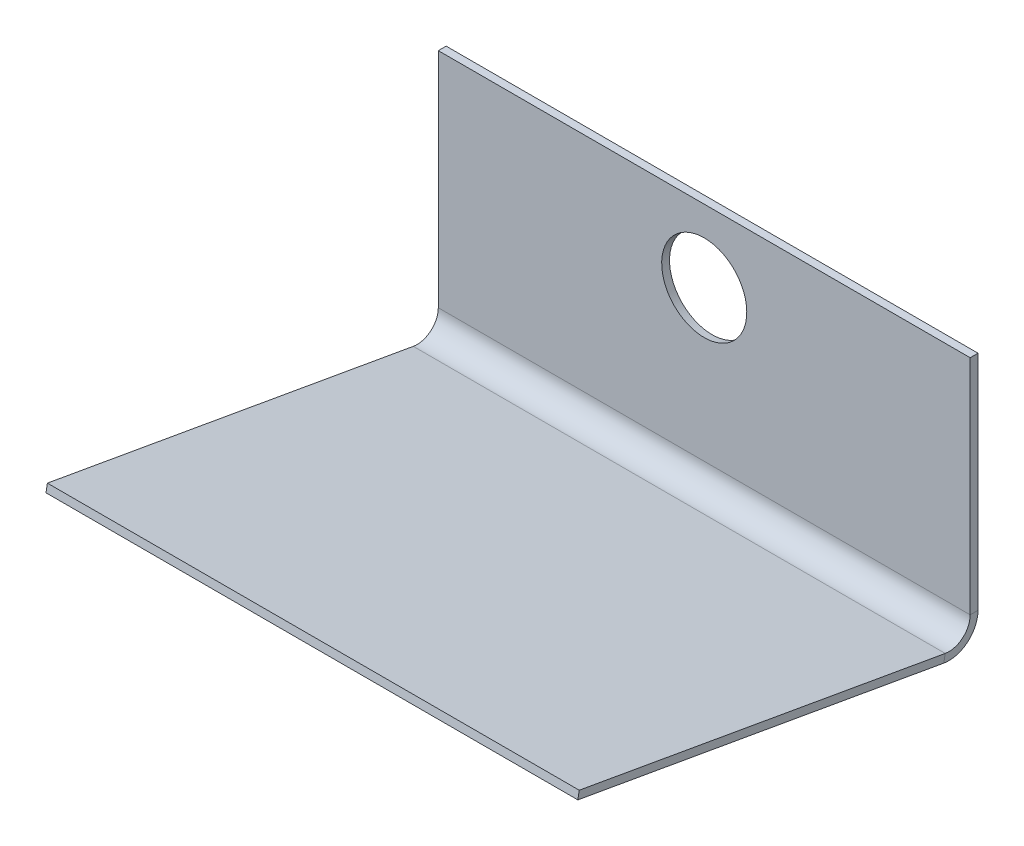
from build123d import *

# Parameters (mm, degrees)
SKETCH1_W               = 50
SKETCH1_H               = 60
BASE_FLANGE1_DEPTH      = 0.7366
SKETCHED_START          = -25
SKETCHED_BEND1_DEPTH    = 50
SKETCHED_BEND1_2_DEPTH  = 50
CUT_EXTRUDE1_DEPTH      = 54.090671485
CUT_EXTRUDE1_DEPTH_BACK = 54.090671485
SKETCH8_R               = 4


# Read off the part's stored shape, not the designer's step: Sketched Bend1
# Sheet-metal steps are written as plain solids
with BuildPart() as part:
    # Sketch1 → Base-Flange1 (new body)
    with BuildSketch(Plane.XY):
        Rectangle(SKETCH1_W, SKETCH1_H)
    extrude(amount=-BASE_FLANGE1_DEPTH)

    # Sketched Bend1 outline → Sketched Bend1 (cut)
    with BuildSketch(Plane.YZ.offset(SKETCHED_START)):
        with BuildLine():
            ThreePointArc((9.066731634, -0.7366), (8.062794494, -0.545798456), (7.198850599, 0))
            Line((7.198850599, 0), (-30, 0))
            Line((-30, 0), (-30, -0.7366))
            Line((-30, -0.7366), (9.066731634, -0.7366))
        make_face()
    extrude(amount=SKETCHED_BEND1_DEPTH, mode=Mode.SUBTRACT)

    # Sketched Bend1 2 outline → Sketched Bend1 2 (add)
    with BuildSketch(Plane.YZ.offset(SKETCHED_START)):
        with BuildLine():
            Line((13.163214519, 36.74984988), (12.437805129, 36.877759128))
            Line((12.437805129, 36.877759128), (6.371706737, 2.475205603))
            ThreePointArc((6.371706737, 2.475205603), (6.471218519, 1.132652762), (7.198850599, 0))
            Line((7.198850599, 0), (9.066731634, 0))
            ThreePointArc((9.066731634, 0), (7.534642748, 0.714424781), (7.097116128, 2.347296355))
            Line((7.097116128, 2.347296355), (13.163214519, 36.74984988))
        make_face()
    extrude(amount=SKETCHED_BEND1_2_DEPTH)

    # Sketch8 → Cut-Extrude1 (cut, two sides: drawn at the far end of the back side and taken through both)
    with BuildSketch(Plane(origin=(0, 0.074278928, 0.849012035), x_dir=(1, 0, 0), z_dir=(0, 0.17364817766693058, 0.984807753012208)).offset(-CUT_EXTRUDE1_DEPTH_BACK)):
        with Locations(Location((0, 22.91937018, 0), (0, 0, 90))):
            Circle(SKETCH8_R)
    extrude(amount=CUT_EXTRUDE1_DEPTH + CUT_EXTRUDE1_DEPTH_BACK, mode=Mode.SUBTRACT)


solid = part.part
